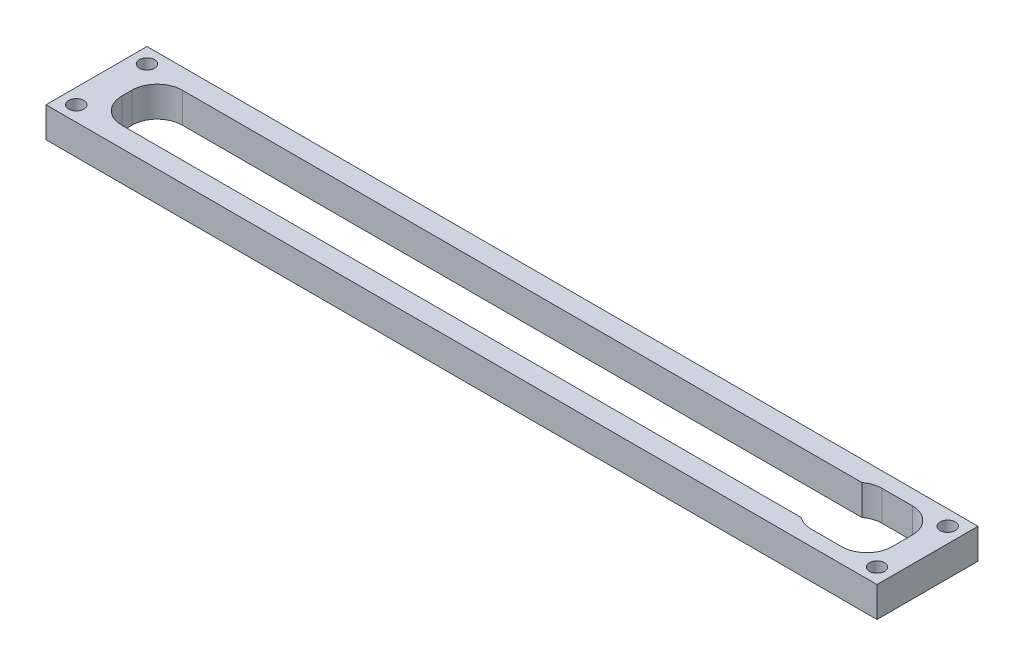
from build123d import *

# Parameters (mm, degrees)
SKETCH1_W           = 164.534777256
SKETCH1_H           = 20
SKETCH1_R           = 1.5
SKETCH1_W_2         = 152.534777256
SKETCH1_H_2         = 12
BOSS_EXTRUDE1_DEPTH = 6
CUT_EXTRUDE1_DEPTH  = 166.854432943
FILLET1_R           = 5


with BuildPart() as part:
    # Sketch1 → Boss-Extrude1 (new body)
    with BuildSketch(Plane(origin=(0, 0, 0), x_dir=(1, 0, 0), z_dir=(0, 1, 0))):
        with Locations((82.267388628, 10)):
            Rectangle(SKETCH1_W, SKETCH1_H)
        with Locations(Location((3, 17, 0), (0, 0, 270))):
            Circle(SKETCH1_R, mode=Mode.SUBTRACT)
        with Locations(Location((3, 3, 0), (0, 0, 90))):
            Circle(SKETCH1_R, mode=Mode.SUBTRACT)
        with Locations(Location((161.534777256, 3, 0), (0, 0, 270))):
            Circle(SKETCH1_R, mode=Mode.SUBTRACT)
        with Locations(Location((161.534777256, 17, 0), (0, 0, 90))):
            Circle(SKETCH1_R, mode=Mode.SUBTRACT)
        with Locations((82.267388628, 10)):
            Rectangle(SKETCH1_W_2, SKETCH1_H_2, mode=Mode.SUBTRACT)
    extrude(amount=BOSS_EXTRUDE1_DEPTH)

    # Sketch2 → Cut-Extrude1 (cut, through all)
    with BuildSketch(Plane(origin=(0, 6, 0), x_dir=(1, 0, 0), z_dir=(0, 1, 0))):
        Polygon((145.534777256, 17), (145.534777256, 16), (158.534777256, 16), (158.534777256, 4), (145.534777256, 4), (145.534777256, 3), (159.534777256, 3), (159.534777256, 17), align=None)
    extrude(amount=-CUT_EXTRUDE1_DEPTH, mode=Mode.SUBTRACT)

    # Fillet1
    # the kernel refuses this fillet: 5 mm, written as the material it adds along each edge
    with BuildSketch(Plane(origin=(159.534777256, 6, -17), x_dir=(0, 0, 1), z_dir=(0, -1, 0)), Plane(origin=(159.534777256, 6, -3), x_dir=(-1, 0, 0), z_dir=(0, -1, 0)), Plane(origin=(6, 0, -16), x_dir=(0, 0, 1), z_dir=(0, 1, 0))) as fillet1_piece_1:
        with BuildLine():
            CenterArc((FILLET1_R, FILLET1_R), FILLET1_R, 180, 90)
            Line((0, FILLET1_R), (-FILLET1_R * 0.02, FILLET1_R))
            Line((-FILLET1_R * 0.02, FILLET1_R), (-FILLET1_R * 0.02, -FILLET1_R * 0.02))
            Line((-FILLET1_R * 0.02, -FILLET1_R * 0.02), (FILLET1_R, -FILLET1_R * 0.02))
            Line((FILLET1_R, -FILLET1_R * 0.02), (FILLET1_R, 0))
        make_face()
    extrude(amount=6)
    with BuildSketch(Plane(origin=(145.534777256, 6, -17), x_dir=(1, 0, 0), z_dir=(0, -1, 0))) as fillet1_piece_2:
        with BuildLine():
            CenterArc((3, 5), FILLET1_R, 233.130102354, 36.869897646)
            Line((0, 1), (-0.06, 0.92))
            ThreePointArc((-0.06, 0.92), (-0.1, 0.5), (-0.1, 0))
            Line((-0.1, 0), (0, -0.1))
            Line((0, -0.1), (3, -0.1))
            Line((3, -0.1), (3, 0))
        make_face()
    extrude(amount=6)
    with BuildSketch(Plane(origin=(145.534777256, 6, -3), x_dir=(0, 0, -1), z_dir=(0, -1, 0))) as fillet1_piece_3:
        with BuildLine():
            CenterArc((5, 3), FILLET1_R, 180, 36.869897646)
            Line((0, 3), (-0.1, 3))
            Line((-0.1, 3), (-0.1, 0))
            Line((-0.1, 0), (0, -0.1))
            ThreePointArc((0, -0.1), (0.5, -0.1), (0.92, -0.06))
            Line((0.92, -0.06), (1, 0))
        make_face()
    extrude(amount=6)
    with BuildSketch(Plane(origin=(6, 0, -4), x_dir=(0, 0, -1), z_dir=(0, 1, 0))) as fillet1_piece_4:
        with BuildLine():
            CenterArc((FILLET1_R, -FILLET1_R), FILLET1_R, 90, 90)
            Line((0, -FILLET1_R), (-FILLET1_R * 0.02, -FILLET1_R))
            Line((-FILLET1_R * 0.02, -FILLET1_R), (-FILLET1_R * 0.02, FILLET1_R * 0.02))
            Line((-FILLET1_R * 0.02, FILLET1_R * 0.02), (FILLET1_R, FILLET1_R * 0.02))
            Line((FILLET1_R, FILLET1_R * 0.02), (FILLET1_R, 0))
        make_face()
    extrude(amount=6)


solid = part.part
